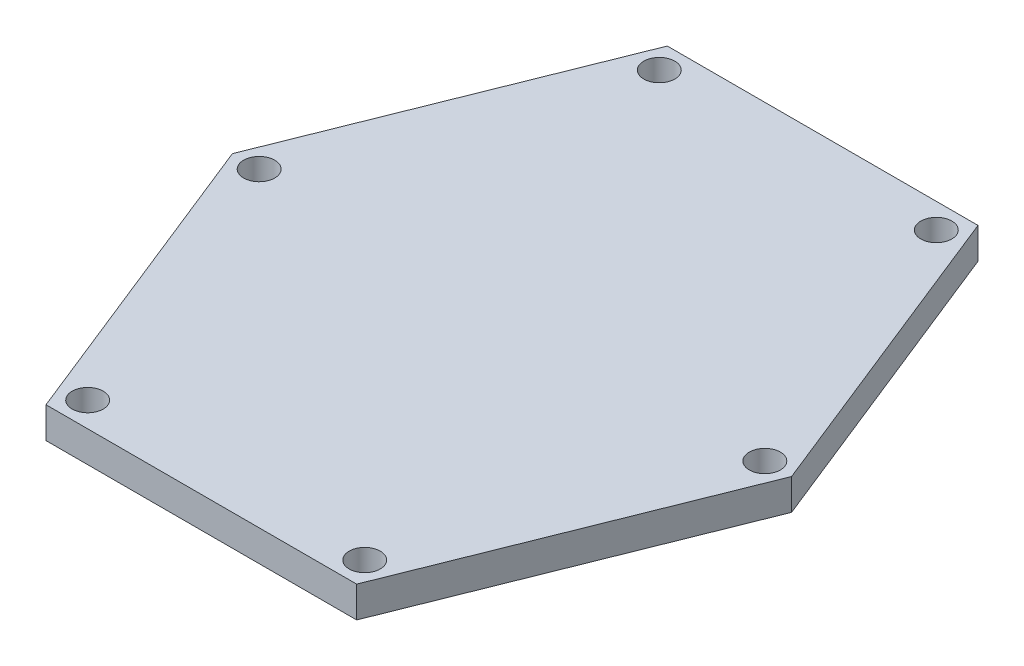
from build123d import *

# Parameters (mm, degrees)
BOSS_EXTRUDE1_DEPTH = 5
SKETCH2_R           = 2.5
CUT_EXTRUDE1_DEPTH  = 5


with BuildPart() as part:
    # Sketch1 → Boss-Extrude1 (new body)
    with BuildSketch(Plane(origin=(0, 0, 0), x_dir=(1, 0, 0), z_dir=(0, 1, 0))):
        Polygon((-25, 42.737330388), (25, 42.737330388), (45, -7.262669612), (25, -57.262669612), (-25, -57.262669612), (-45, -7.262669612), align=None)
    extrude(amount=BOSS_EXTRUDE1_DEPTH)

    # Sketch2 → Cut-Extrude1 (cut)
    with BuildSketch(Plane(origin=(0, 5, 0), x_dir=(1, 0, 0), z_dir=(0, 1, 0))):
        with Locations((-22.291868154, 38.737330388)):
            Circle(SKETCH2_R)
        with Locations((22.291868154, 38.737330388)):
            Circle(SKETCH2_R)
        with Locations((-40.691868154, -7.262669612)):
            Circle(SKETCH2_R)
        with Locations((40.691868154, -7.262669612)):
            Circle(SKETCH2_R)
        with Locations((-22.291868154, -53.262669612)):
            Circle(SKETCH2_R)
        with Locations((22.291868154, -53.262669612)):
            Circle(SKETCH2_R)
    extrude(amount=-CUT_EXTRUDE1_DEPTH, mode=Mode.SUBTRACT)


solid = part.part
